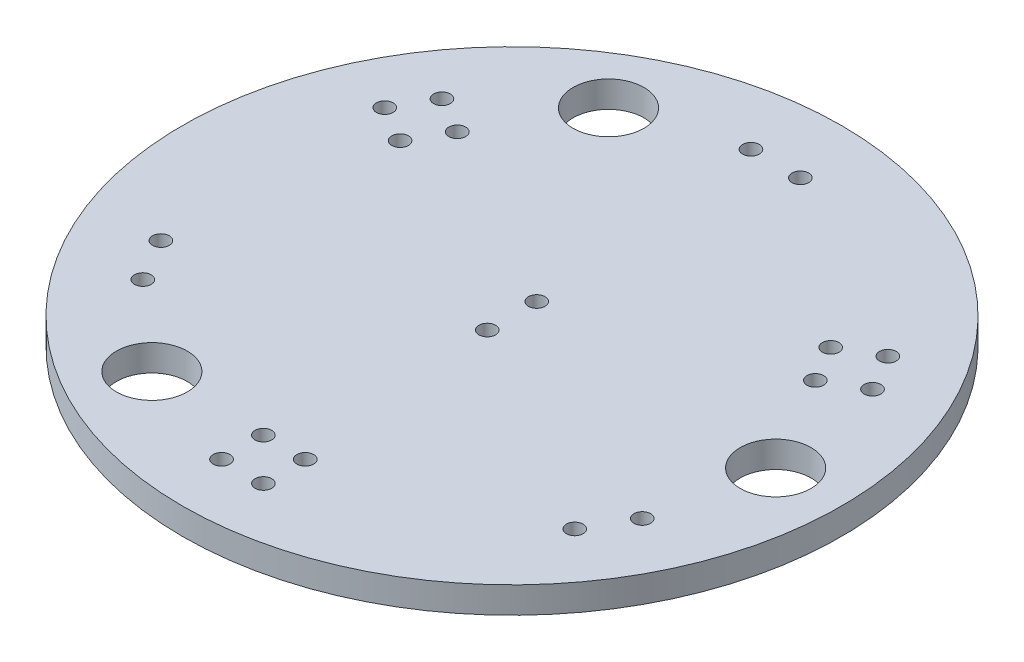
from build123d import *

# Parameters (mm, degrees)
SKETCH1_R           = 20
BOSS_EXTRUDE1_DEPTH = 1.6
SKETCH2_R           = 2.15
CUT_EXTRUDE1_DEPTH  = 29.329489935
SKETCH3_R           = 0.508
CUT_EXTRUDE2_DEPTH  = 29.329489935


with BuildPart() as part:
    # Sketch1 → Boss-Extrude1 (new body)
    with BuildSketch(Plane(origin=(0, 0, 0), x_dir=(1, 0, 0), z_dir=(0, 1, 0))):
        Circle(SKETCH1_R)
    extrude(amount=BOSS_EXTRUDE1_DEPTH)

    # Sketch2 → Cut-Extrude1 (cut, through all)
    with BuildSketch(Plane(origin=(0, 1.6, 0), x_dir=(1, 0, 0), z_dir=(0, 1, 0))):
        with Locations((16, 0)):
            Circle(SKETCH2_R)
        with Locations((-8, -13.856406461)):
            Circle(SKETCH2_R)
        with Locations((-8, 13.856406461)):
            Circle(SKETCH2_R)
    extrude(amount=-CUT_EXTRUDE1_DEPTH, mode=Mode.SUBTRACT)

    # Sketch3 → Cut-Extrude2 (cut, through all)
    with BuildSketch(Plane(origin=(0, 1.6, 0), x_dir=(1, 0, 0), z_dir=(0, 1, 0))):
        with Locations((-1.27, -13.817)):
            Circle(SKETCH3_R)
        with Locations((-1.27, -16.357)):
            Circle(SKETCH3_R)
        with Locations((1.27, -13.817)):
            Circle(SKETCH3_R)
        with Locations((1.27, -16.357)):
            Circle(SKETCH3_R)
        with Locations((-11.330873004, 8.008352263)):
            Circle(SKETCH3_R)
        with Locations((-13.53057753, 9.278352263)):
            Circle(SKETCH3_R)
        with Locations((-12.600873004, 5.808647737)):
            Circle(SKETCH3_R)
        with Locations((-14.80057753, 7.078647737)):
            Circle(SKETCH3_R)
        with Locations((12.600873004, 5.808647737)):
            Circle(SKETCH3_R)
        with Locations((14.80057753, 7.078647737)):
            Circle(SKETCH3_R)
        with Locations((11.330873004, 8.008352263)):
            Circle(SKETCH3_R)
        with Locations((13.53057753, 9.278352263)):
            Circle(SKETCH3_R)
        with Locations((0, 1.5)):
            Circle(SKETCH3_R)
        with Locations((0, -1.5)):
            Circle(SKETCH3_R)
        with Locations((1.5, 16)):
            Circle(SKETCH3_R)
        with Locations((-1.5, 16)):
            Circle(SKETCH3_R)
        with Locations((13.106406461, -9.299038106)):
            Circle(SKETCH3_R)
        with Locations((14.606406461, -6.700961894)):
            Circle(SKETCH3_R)
        with Locations((-14.606406461, -6.700961894)):
            Circle(SKETCH3_R)
        with Locations((-13.106406461, -9.299038106)):
            Circle(SKETCH3_R)
    extrude(amount=-CUT_EXTRUDE2_DEPTH, mode=Mode.SUBTRACT)


solid = part.part
